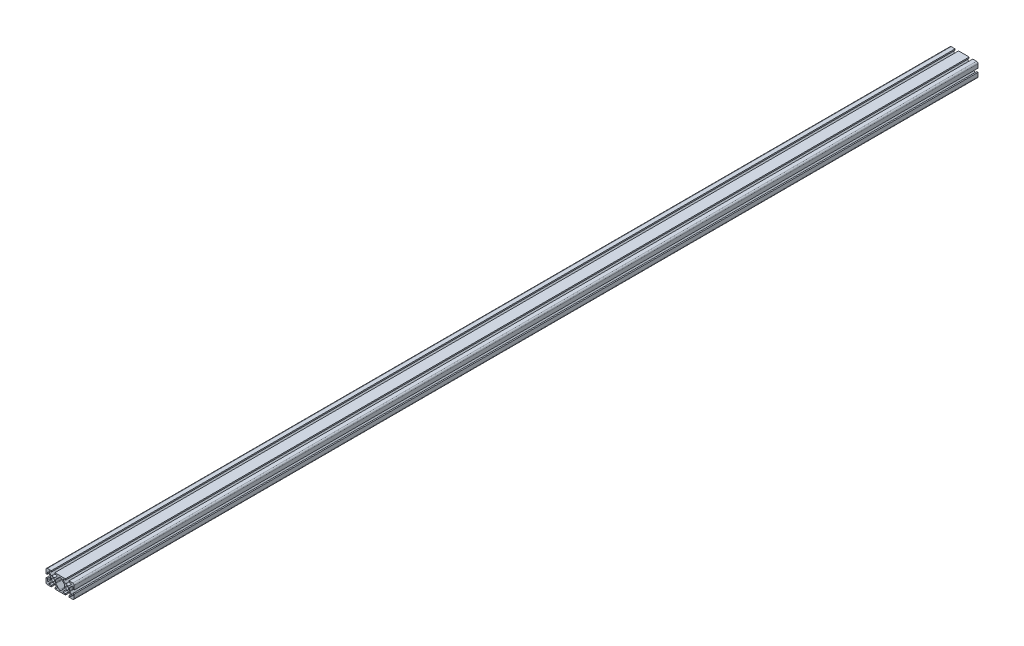
from build123d import *

# Parameters (mm, degrees)
BOSS_EXTRUDE1_DEPTH = 640
BOSS_EXTRUDE2_DEPTH = 640
FILLET1_R           = 0.75
FILLET2_R           = 1.25


with BuildPart() as part:
    # Sketch3 → Boss-Extrude1 (new, symmetric)
    with BuildSketch(Plane.XY):
        with BuildLine():
            Line((12.5, -10), (17.9, -10))
            ThreePointArc((17.9, -10), (19.38492424, -9.38492424), (20, -7.9))
            Line((20, -7.9), (20, -2.5))
            Line((20, -2.5), (18.213351365, -2.5))
            Line((18.213351365, -2.5), (18.213351365, -6.95))
            Line((18.213351365, -6.95), (13.6, -2.336648635))
            Line((13.6, -2.336648635), (13.6, 0))
            Line((13.6, 0), (12.15, 0))
            ThreePointArc((12.15, 0), (11.52027958, -1.52027958), (10, -2.15))
            Line((10, -2.15), (10, -3.6))
            Line((10, -3.6), (12.336648635, -3.6))
            Line((12.336648635, -3.6), (16.95, -8.213351365))
            Line((16.95, -8.213351365), (12.5, -8.213351365))
            Line((12.5, -8.213351365), (12.5, -10))
        make_face()
    extrude(amount=BOSS_EXTRUDE1_DEPTH, both=True)

    # Sketch4 → Boss-Extrude2 (add, symmetric)
    with BuildSketch(Plane.XY):
        with BuildLine():
            Line((10, -3.6), (7.663351365, -3.6))
            Line((7.663351365, -3.6), (3.05, -8.213351365))
            Line((3.05, -8.213351365), (7.5, -8.213351365))
            Line((7.5, -8.213351365), (7.5, -10))
            Line((7.5, -10), (0, -10))
            Line((0, -10), (0, -8.736648635))
            Line((0, -8.736648635), (6.4, -2.336648635))
            Line((6.4, -2.336648635), (6.4, 0))
            Line((6.4, 0), (7.85, 0))
            ThreePointArc((7.85, 0), (8.47972042, -1.52027958), (10, -2.15))
            Line((10, -2.15), (10, -3.6))
        make_face()
    extrude(amount=BOSS_EXTRUDE2_DEPTH, both=True)

    # Mirror1: part across plane


with BuildPart() as part_1:
    add(part.part)
    add(part.part.mirror(Plane(origin=(0, 0, 0), x_dir=(0, 0, 1), z_dir=(1, 0, 0))))

    # Mirror2: part across plane


with BuildPart() as part_2:
    add(part_1.part)
    add(part_1.part.mirror(Plane.ZX))

    # Fillet1
    fillet1_edges = [part_2.edges().sort_by_distance(p)[0] for p in [
        (-7.663351365, -3.6, 0),
        (-12.336648635, -3.6, 0),
        (12.336648635, -3.6, 0),
        (7.663351365, -3.6, 0),
        (-3.05, -8.213351365, 0),
        (-18.213351365, -6.95, 0),
        (-16.95, -8.213351365, 0),
        (-13.6, -2.336648635, 0),
        (-18.213351365, 6.95, 0),
        (-16.95, 8.213351365, 0),
        (-12.336648635, 3.6, 0),
        (-7.663351365, 3.6, 0),
        (-13.6, 2.336648635, 0),
        (-3.05, 8.213351365, 0),
        (3.05, 8.213351365, 0),
        (13.6, -2.336648635, 0),
        (13.6, 2.336648635, 0),
        (7.663351365, 3.6, 0),
        (12.336648635, 3.6, 0),
        (18.213351365, 6.95, 0),
        (16.95, 8.213351365, 0),
        (18.213351365, -6.95, 0),
        (16.95, -8.213351365, 0),
        (3.05, -8.213351365, 0),
    ]]
    fillet(fillet1_edges, radius=FILLET1_R)

    # Fillet2
    fillet2_edges = [part_2.edges().sort_by_distance(p)[0] for p in [
        (0, -8.736648635, 0),
        (-6.4, -2.336648635, 0),
        (-6.4, 2.336648635, 0),
        (6.4, -2.336648635, 0),
        (6.4, 2.336648635, 0),
        (0, 8.736648635, 0),
    ]]
    fillet(fillet2_edges, radius=FILLET2_R)


solid = part_2.part
